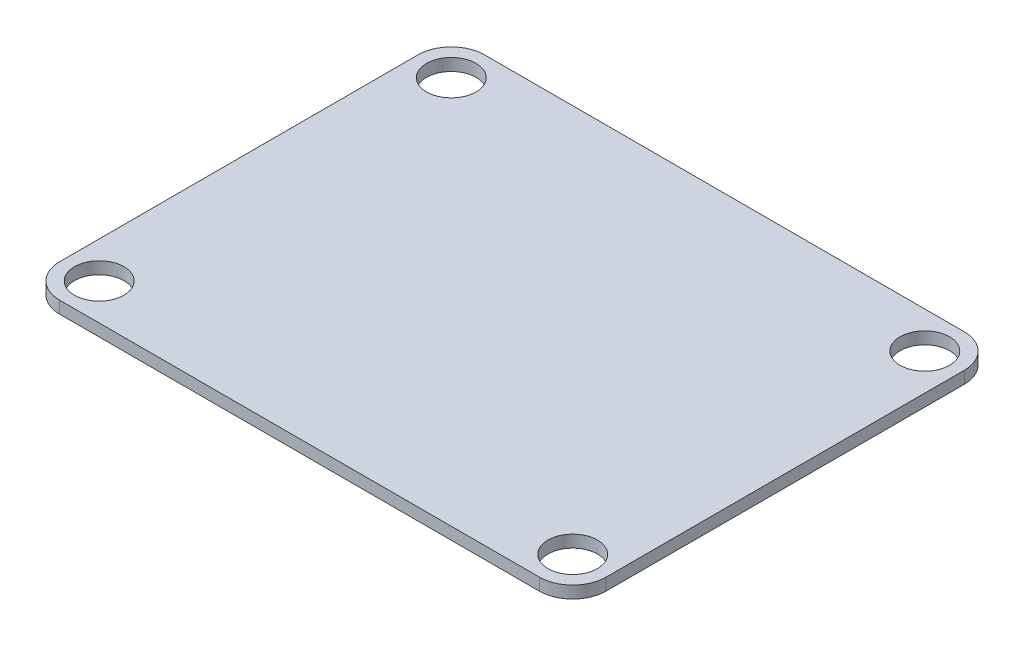
from build123d import *

# Parameters (mm, degrees)
SKETCH1_W           = 228.6
SKETCH1_H           = 177.8
BOSS_EXTRUDE1_DEPTH = 5.08
SKETCH2_R           = 10.3505
CUT_EXTRUDE1_DEPTH  = 145.891360681
FILLET3_R           = 13.97


with BuildPart() as part:
    # Sketch1 → Boss-Extrude1 (new body)
    with BuildSketch(Plane(origin=(0, 0, 0), x_dir=(1, 0, 0), z_dir=(0, 1, 0))):
        Rectangle(SKETCH1_W, SKETCH1_H)
    extrude(amount=BOSS_EXTRUDE1_DEPTH)

    # Sketch2 → Cut-Extrude1 (cut, through all)
    with BuildSketch(Plane(origin=(0, 5.08, 0), x_dir=(1, 0, 0), z_dir=(0, 1, 0))):
        with Locations((-99.06, 73.66)):
            Circle(SKETCH2_R)
        with Locations((99.06, 73.66)):
            Circle(SKETCH2_R)
        with Locations((99.06, -73.66)):
            Circle(SKETCH2_R)
        with Locations((-99.06, -73.66)):
            Circle(SKETCH2_R)
    extrude(amount=-CUT_EXTRUDE1_DEPTH, mode=Mode.SUBTRACT)

    # Fillet3
    fillet3_edges = [part.edges().sort_by_distance(p)[0] for p in [
        (114.3, 2.54, -88.9),
        (114.3, 2.54, 88.9),
        (-114.3, 2.54, -88.9),
        (-114.3, 2.54, 88.9),
    ]]
    fillet(fillet3_edges, radius=FILLET3_R)


solid = part.part
